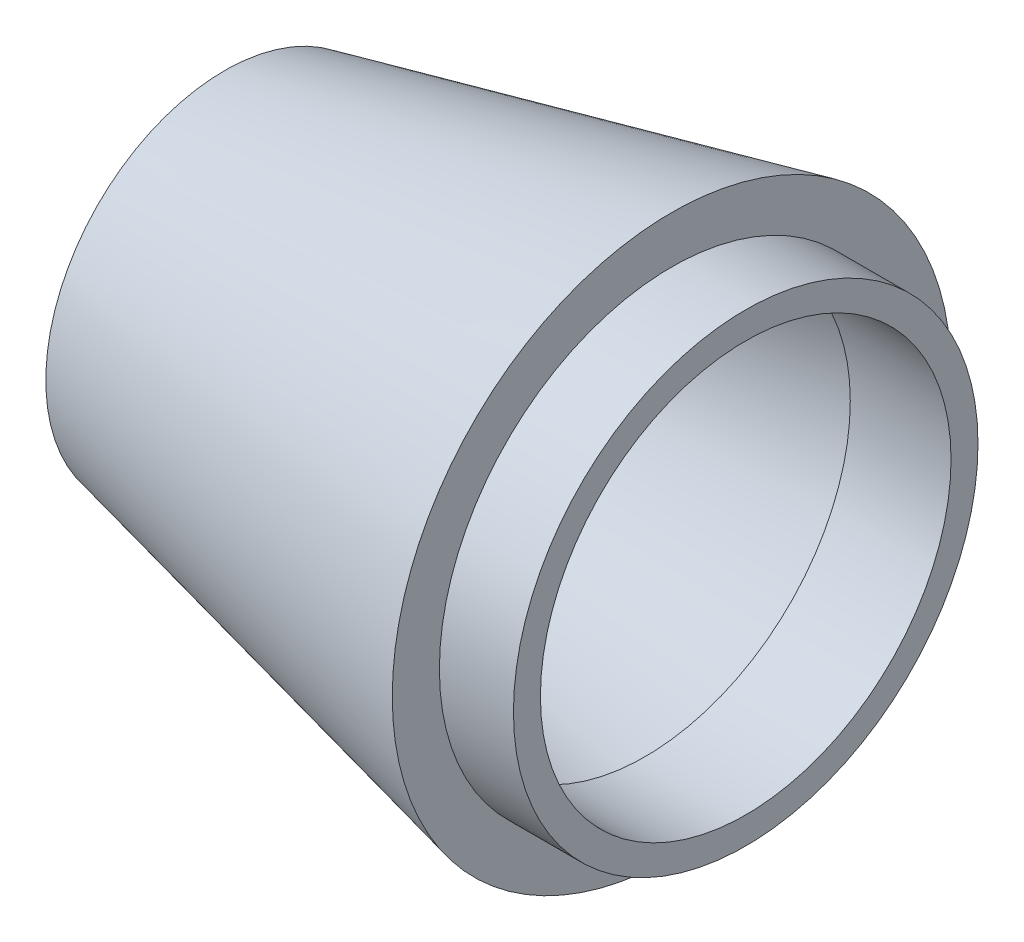
from build123d import *


with BuildPart() as part:
    # Sketch1 → Revolve4 (revolve)
    with BuildSketch(Plane.XY):
        Polygon((-12.065, 10.16), (-12.065, 7.62), (-0.848332369, 10.083099515), (-0.848332369, 0), (0.635, 0), (0.635, 10.408828632), (11.818240054, 12.864587691), (11.818240054, 11.665851292), (17.5428164, 11.665851292), (17.5428164, 13.197657263), (13.335, 13.197657263), (13.335, 15.875), align=None)
    revolve(axis=Axis((44.726440805, 0, 0), (-1, 0, 0)))


solid = part.part
